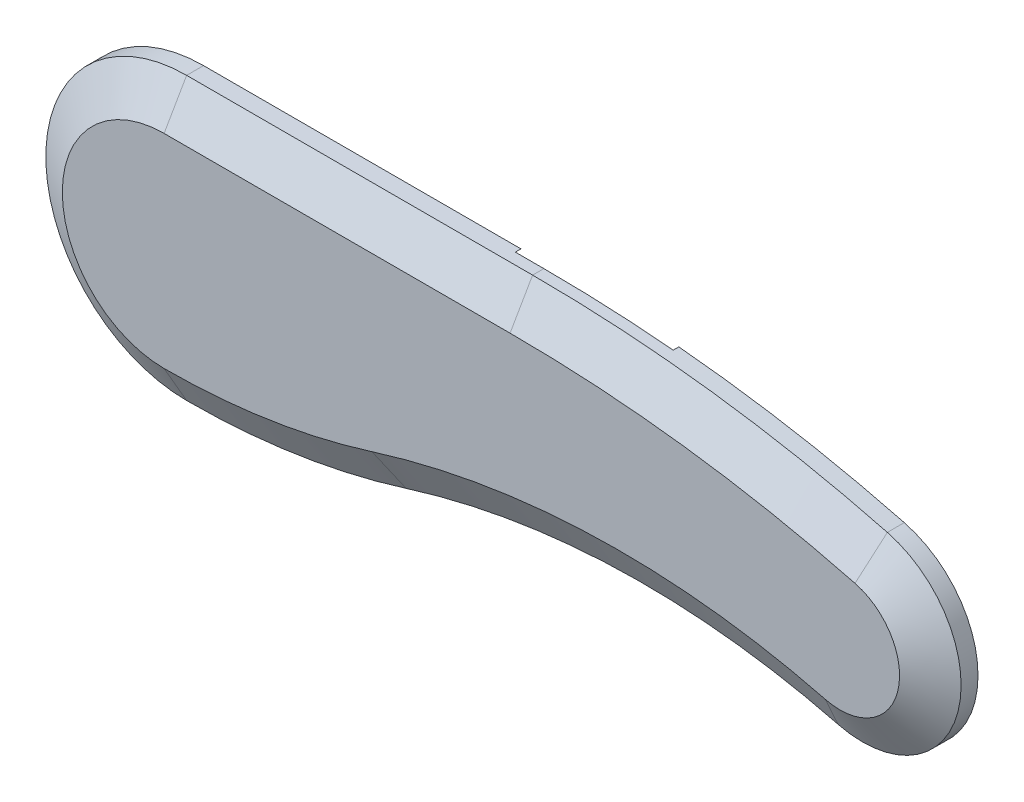
from build123d import *
from OCP.BRepFilletAPI import BRepFilletAPI_MakeChamfer

# Parameters (mm, degrees)
BOSS_EXTRUDE1_DEPTH = 7
CHAMFER1_SIZE       = 4
CHAMFER1_SIZE2      = 6.92820323
SKETCH3_R           = 8.5
CUT_EXTRUDE2_DEPTH  = 4
CUT_EXTRUDE3_DEPTH  = 3.5
SKETCH5_3_R         = 2.125
CUT_EXTRUDE4_DEPTH  = 140.826678427
CHAMFER2_SIZE       = 0.5
CHAMFER2_SIZE2      = 1.37373871
BOSS_EXTRUDE2_START = 0.5
SKETCH7_R           = 9.5
SKETCH7_R_2         = 8.5
BOSS_EXTRUDE2_DEPTH = 0.5
CUT_EXTRUDE5_DEPTH  = 1


with BuildPart() as part:
    # Sketch1 → Boss-Extrude1 (new body)
    with BuildSketch(Plane.XY):
        with BuildLine():
            Line((61.423127431, 25), (0, 25))
            ThreePointArc((0, 25), (-25, 0), (0, -25))
            ThreePointArc((0, -25), (19.714733683, -23.496417366), (38.973425347, -19.020450397))
            ThreePointArc((38.973425347, -19.020450397), (77.172636951, -12.631763464), (115.660534054, -16.953437271))
            ThreePointArc((115.660534054, -16.953437271), (136.944496251, -4.374248141), (124.409011914, 16.935483871))
            ThreePointArc((124.409011914, 16.935483871), (93.173159181, 22.975675186), (61.423127431, 25))
        make_face()
    extrude(amount=BOSS_EXTRUDE1_DEPTH)

    # Chamfer1: one chamfer whose edges measure the first distance from different faces: ONE call of the kernel's chamfer builder (chamfer() names one face for all edges)
    chamfer1_edges_1 = [part.edges().sort_by_distance(p)[0] for p in [
        (19.714733683, -23.496417366, 7),
    ]]
    chamfer1_side_1 = [part.faces().sort_by_distance(p)[0] for p in [
        (19.714733683, -23.496417366, 3.5),
    ]]
    chamfer1_edges_2 = [part.edges().sort_by_distance(p)[0] for p in [
        (-25, 0, 7),
    ]]
    chamfer1_side_2 = [part.faces().sort_by_distance(p)[0] for p in [
        (-25, 0, 3.5),
    ]]
    chamfer1_edges_3 = [part.edges().sort_by_distance(p)[0] for p in [
        (30.711563715, 25, 7),
    ]]
    chamfer1_side_3 = [part.faces().sort_by_distance(p)[0] for p in [
        (30.711563715, 25, 3.5),
    ]]
    chamfer1_edges_4 = [part.edges().sort_by_distance(p)[0] for p in [
        (93.173159181, 22.975675186, 7),
    ]]
    chamfer1_side_4 = [part.faces().sort_by_distance(p)[0] for p in [
        (93.173159181, 22.975675186, 3.5),
    ]]
    chamfer1_edges_5 = [part.edges().sort_by_distance(p)[0] for p in [
        (136.944496251, -4.374248141, 7),
    ]]
    chamfer1_side_5 = [part.faces().sort_by_distance(p)[0] for p in [
        (136.944496251, -4.374248141, 3.5),
    ]]
    chamfer1_edges_6 = [part.edges().sort_by_distance(p)[0] for p in [
        (77.172636951, -12.631763464, 7),
    ]]
    chamfer1_side_6 = [part.faces().sort_by_distance(p)[0] for p in [
        (77.172636951, -12.631763464, 3.5),
    ]]
    chamfer1 = BRepFilletAPI_MakeChamfer(part.part.solid().wrapped)
    for e in chamfer1_edges_1:
        chamfer1.Add(CHAMFER1_SIZE, CHAMFER1_SIZE2, e.wrapped, chamfer1_side_1[0].wrapped)  # the first distance lies on this face
    for e in chamfer1_edges_2:
        chamfer1.Add(CHAMFER1_SIZE, CHAMFER1_SIZE2, e.wrapped, chamfer1_side_2[0].wrapped)  # the first distance lies on this face
    for e in chamfer1_edges_3:
        chamfer1.Add(CHAMFER1_SIZE, CHAMFER1_SIZE2, e.wrapped, chamfer1_side_3[0].wrapped)  # the first distance lies on this face
    for e in chamfer1_edges_4:
        chamfer1.Add(CHAMFER1_SIZE, CHAMFER1_SIZE2, e.wrapped, chamfer1_side_4[0].wrapped)  # the first distance lies on this face
    for e in chamfer1_edges_5:
        chamfer1.Add(CHAMFER1_SIZE, CHAMFER1_SIZE2, e.wrapped, chamfer1_side_5[0].wrapped)  # the first distance lies on this face
    for e in chamfer1_edges_6:
        chamfer1.Add(CHAMFER1_SIZE, CHAMFER1_SIZE2, e.wrapped, chamfer1_side_6[0].wrapped)  # the first distance lies on this face
    add(Compound.cast(chamfer1.Shape()), mode=Mode.REPLACE)

    # Sketch3 → Cut-Extrude2 (cut)
    with BuildSketch(Plane(origin=(0, 0, 0), x_dir=(-1, 0, 0), z_dir=(0, 0, -1))):
        Circle(SKETCH3_R)
        with Locations((-120, 0)):
            Circle(SKETCH3_R)
    extrude(amount=-CUT_EXTRUDE2_DEPTH, mode=Mode.SUBTRACT)

    # Sketch5 → Cut-Extrude3 (cut)
    with BuildSketch(Plane(origin=(0, 0, 2.5), x_dir=(-1, 0, 0), z_dir=(0, 0, -1))):
        with BuildLine():
            Line((-86.046403676, 16.921929528), (-88.139298402, 13.296929528))
            Line((-88.139298402, 13.296929528), (-86.046403676, 9.671929528))
            Line((-86.046403676, 9.671929528), (-78.548867374, 9.671929528))
            ThreePointArc((-78.548867374, 9.671929528), (-67.767719499, 13.296929528), (-78.548867374, 16.921929528))
            Line((-78.548867374, 16.921929528), (-86.046403676, 16.921929528))
        make_face()
        with BuildLine():
            Line((-62.092894726, -3.625), (-54.595358423, -3.625))
            ThreePointArc((-54.595358423, -3.625), (-43.814210548, 0), (-54.595358423, 3.625))
            Line((-54.595358423, 3.625), (-62.092894726, 3.625))
            Line((-62.092894726, 3.625), (-64.185789452, 0))
            Line((-64.185789452, 0), (-62.092894726, -3.625))
        make_face()
        with BuildLine():
            Line((-32.163058591, -14.569644586), (-24.665522288, -14.569644586))
            ThreePointArc((-24.665522288, -14.569644586), (-13.884374414, -10.944644586), (-24.665522288, -7.319644586))
            Line((-24.665522288, -7.319644586), (-32.163058591, -7.319644586))
            Line((-32.163058591, -7.319644586), (-34.255953317, -10.944644586))
            Line((-34.255953317, -10.944644586), (-32.163058591, -14.569644586))
        make_face()
    extrude(amount=-CUT_EXTRUDE3_DEPTH, mode=Mode.SUBTRACT)

    # Sketch5<3> → Cut-Extrude4 (cut, through all)
    with BuildSketch(Plane(origin=(0, 0, 2.5), x_dir=(-1, 0, 0), z_dir=(0, 0, -1))):
        with BuildLine():
            ThreePointArc((-78.548867374, 9.671929528), (-67.767719499, 13.296929528), (-78.548867374, 16.921929528))
            ThreePointArc((-78.548867374, 16.921929528), (-79.767719499, 13.296929528), (-78.548867374, 9.671929528))
        make_face()
        with BuildLine():
            ThreePointArc((-54.595358423, 3.625), (-55.814210548, 0), (-54.595358423, -3.625))
            ThreePointArc((-54.595358423, -3.625), (-43.814210548, 0), (-54.595358423, 3.625))
        make_face()
        with BuildLine():
            ThreePointArc((-24.665522288, -7.319644586), (-25.884374414, -10.944644586), (-24.665522288, -14.569644586))
            ThreePointArc((-24.665522288, -14.569644586), (-13.884374414, -10.944644586), (-24.665522288, -7.319644586))
        make_face()
        with Locations((-83.953508951, 13.296929528)):
            Circle(SKETCH5_3_R)
        with Locations((-60, 0)):
            Circle(SKETCH5_3_R)
        with Locations((-30.070163865, -10.944644586)):
            Circle(SKETCH5_3_R)
    extrude(amount=CUT_EXTRUDE4_DEPTH, mode=Mode.SUBTRACT)

    # Chamfer2: one chamfer whose edges measure the first distance from different faces: ONE call of the kernel's chamfer builder (chamfer() names one face for all edges)
    chamfer2_edges_1 = [part.edges().sort_by_distance(p)[0] for p in [
        (67.767719499, 13.296929528, 6),
    ]]
    chamfer2_side_1 = [part.faces().sort_by_distance(p)[0] for p in [
        (68.986571624, 9.671929528, 3),
    ]]
    chamfer2_edges_2 = [part.edges().sort_by_distance(p)[0] for p in [
        (13.884374414, -10.944644586, 6),
    ]]
    chamfer2_side_2 = [part.faces().sort_by_distance(p)[0] for p in [
        (15.103226539, -14.569644586, 3),
    ]]
    chamfer2_edges_3 = [part.edges().sort_by_distance(p)[0] for p in [
        (43.814210548, 0, 6),
    ]]
    chamfer2_side_3 = [part.faces().sort_by_distance(p)[0] for p in [
        (45.033062674, -3.625, 3),
    ]]
    chamfer2 = BRepFilletAPI_MakeChamfer(part.part.solid().wrapped)
    for e in chamfer2_edges_1:
        chamfer2.Add(CHAMFER2_SIZE, CHAMFER2_SIZE2, e.wrapped, chamfer2_side_1[0].wrapped)  # the first distance lies on this face
    for e in chamfer2_edges_2:
        chamfer2.Add(CHAMFER2_SIZE, CHAMFER2_SIZE2, e.wrapped, chamfer2_side_2[0].wrapped)  # the first distance lies on this face
    for e in chamfer2_edges_3:
        chamfer2.Add(CHAMFER2_SIZE, CHAMFER2_SIZE2, e.wrapped, chamfer2_side_3[0].wrapped)  # the first distance lies on this face
    add(Compound.cast(chamfer2.Shape()), mode=Mode.REPLACE)

    # Sketch7 → Boss-Extrude2 (add)
    # profile 1 of 2: a face of its own
    with BuildSketch(Plane(origin=(0, 0, 0), x_dir=(-1, 0, 0), z_dir=(0, 0, -1)).offset(BOSS_EXTRUDE2_START)):
        Circle(SKETCH7_R)
        Circle(SKETCH7_R_2, mode=Mode.SUBTRACT)
    # profile 2 of 2: a face of its own
    with BuildSketch(Plane(origin=(0, 0, 0), x_dir=(-1, 0, 0), z_dir=(0, 0, -1)).offset(BOSS_EXTRUDE2_START)):
        with Locations((-120, 0)):
            Circle(SKETCH7_R)
        with Locations((-120, 0)):
            Circle(SKETCH7_R_2, mode=Mode.SUBTRACT)
    extrude(amount=-BOSS_EXTRUDE2_DEPTH)

    # Sketch8 → Cut-Extrude5 (cut)
    with BuildSketch(Plane(origin=(0, 0, 0), x_dir=(-1, 0, 0), z_dir=(0, 0, -1))):
        with BuildLine():
            Line((-89.428119539, 18.972729025), (-93.616268896, 7.465883237))
            ThreePointArc((-93.616268896, 7.465883237), (-93.832692842, 2.508959933), (-91.166802555, -1.675649601))
            Line((-91.166802555, -1.675649601), (-80.016279798, -11.032049133))
            ThreePointArc((-80.016279798, -11.032049133), (-77.697567105, -12.403511526), (-75.060647403, -12.954866342))
            ThreePointArc((-75.060647403, -12.954866342), (-56.847470563, -14.924185147), (-39.048374242, -19.258951263))
            ThreePointArc((-39.048374242, -19.258951263), (-29.540851985, -21.855825897), (-19.864187883, -23.726363033))
            ThreePointArc((-19.864187883, -23.726363033), (-13.388522585, -21.963525136), (-10.365633414, -15.971532183))
            ThreePointArc((-10.365633414, -15.971532183), (-11.215405969, -12.703904149), (-13.30299778, -10.050327921))
            Line((-13.30299778, -10.050327921), (-53.072047052, 23.319866656))
            ThreePointArc((-53.072047052, 23.319866656), (-55.55337865, 24.752464121), (-58.375044832, 25.25))
            Line((-58.375044832, 25.25), (-61.423127431, 25.25))
            ThreePointArc((-61.423127431, 25.25), (-71.903800566, 25.030434129), (-82.366082508, 24.372121803))
            ThreePointArc((-82.366082508, 24.372121803), (-86.68653993, 22.704957593), (-89.428119539, 18.972729025))
        make_face()
    extrude(amount=-CUT_EXTRUDE5_DEPTH, mode=Mode.SUBTRACT)


solid = part.part
